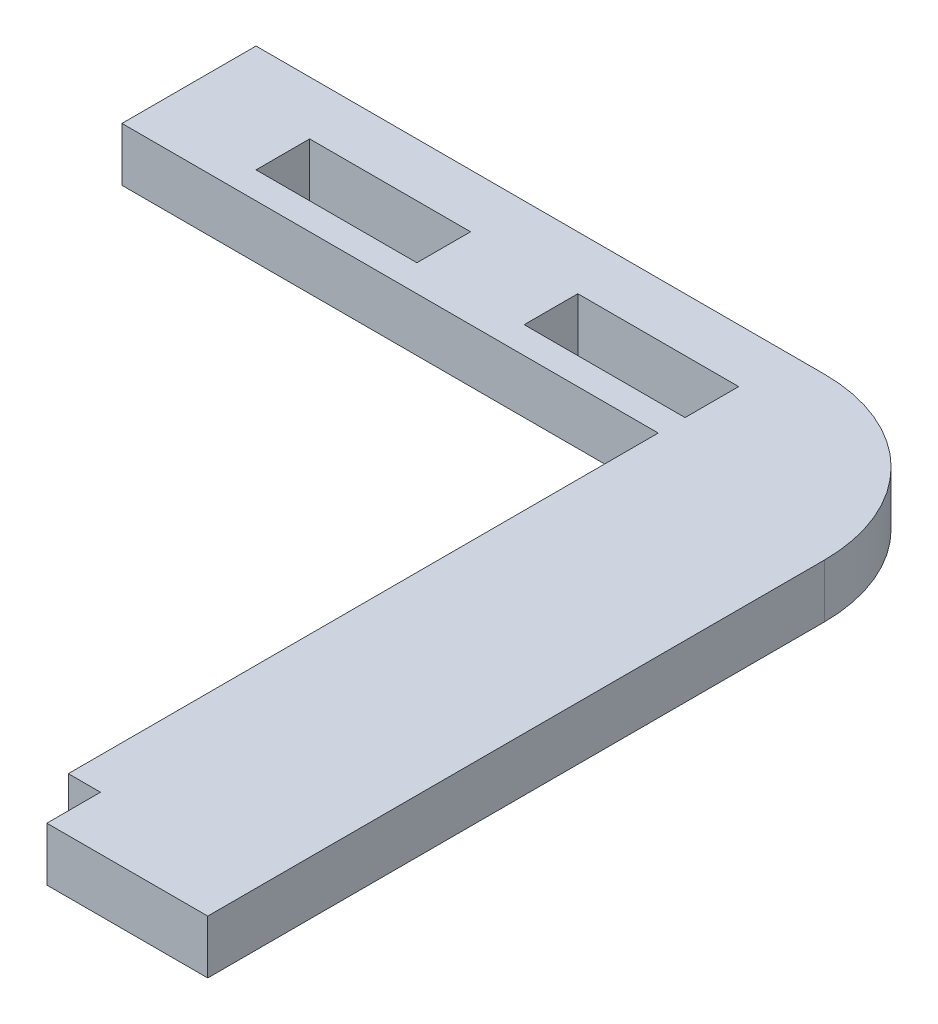
from build123d import *

# Parameters (mm, degrees)
SKETCH1_W           = 15
SKETCH1_H           = 5
BOSS_EXTRUDE1_DEPTH = 5
FILLET3_R           = 15


with BuildPart() as part:
    # Sketch1 → Boss-Extrude1 (new body)
    with BuildSketch(Plane(origin=(0, 0, 0), x_dir=(1, 0, 0), z_dir=(0, 1, 0))):
        Polygon((-34, -17.5), (-37, -17.5), (-37, 37.5), (-87, 37.5), (-87, 50), (-19, 50), (-19, -22.5), (-34, -22.5), align=None)
        with Locations((-69.5, 42.5)):
            Rectangle(SKETCH1_W, SKETCH1_H, mode=Mode.SUBTRACT)
        with Locations((-44.5, 42.5)):
            Rectangle(SKETCH1_W, SKETCH1_H, mode=Mode.SUBTRACT)
    extrude(amount=BOSS_EXTRUDE1_DEPTH)

    # Fillet3
    fillet3_edges = [part.edges().sort_by_distance(p)[0] for p in [
        (-19, 2.5, -50),
    ]]
    fillet(fillet3_edges, radius=FILLET3_R)


solid = part.part
